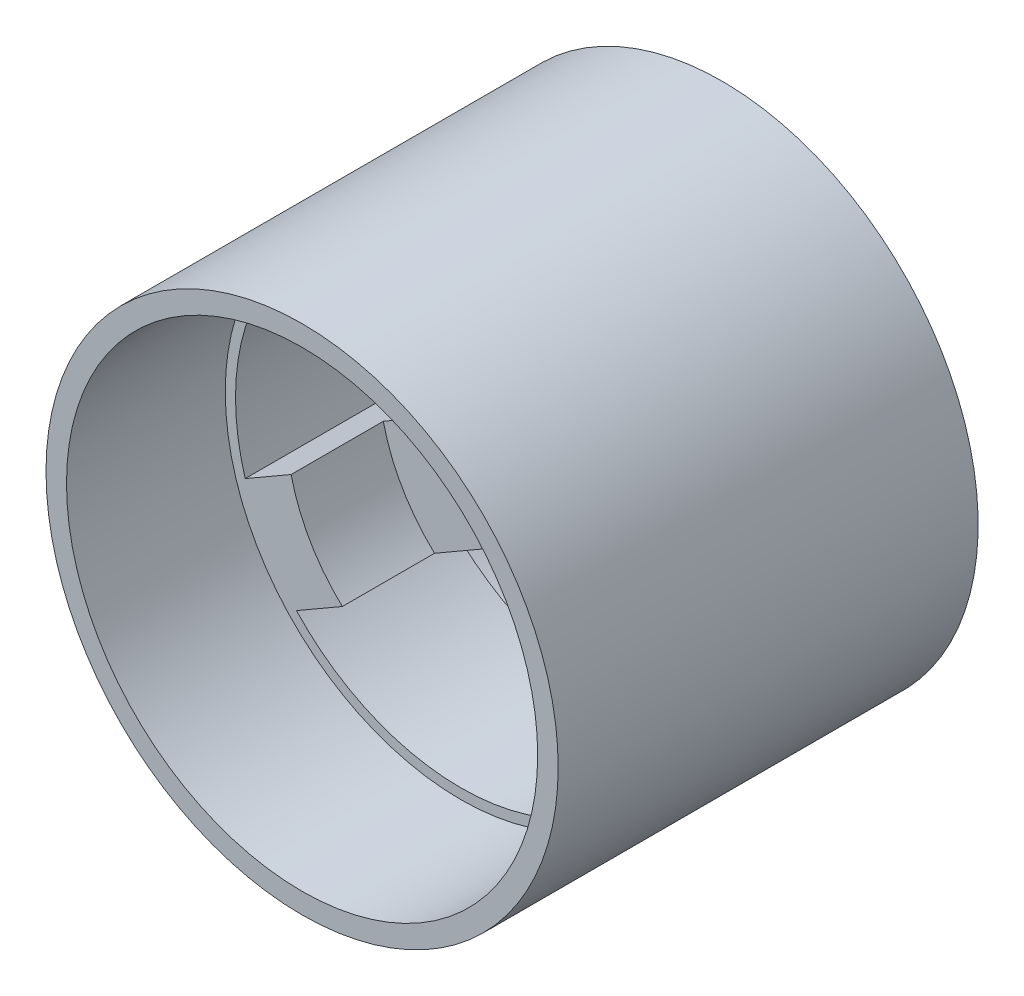
from build123d import *

# Parameters (mm, degrees)
SKETCH_1_R          = 22
SKETCH_1_R_2        = 17
EXTRUDE_1_DEPTH     = 9
EXTRUDE_START       = 3
SKETCH_2_R          = 22
EXTRUDE_2_DEPTH     = 3
SKETCH_3_R          = 1
CUT_EXTRUDE_1_DEPTH = 3
CUT_EXTRUDE_2_DEPTH = 25
SKETCH_5_R          = 4
CUT_EXTRUDE_3_DEPTH = 10
FILLET_1_R          = 10
FILLET_2_R          = 10
SKETCH_7_R          = 25
SKETCH_7_R_2        = 22
EXTRUDE_3_DEPTH     = 30
EXTRUDE_START_2     = 4
EXTRUDE_4_DEPTH     = 4
SKETCH_9_R          = 38.67245247
CUT_EXTRUDE_4_DEPTH = 1
EXTRUDE_START_3     = 13.5
SKETCH_10_R         = 25
SKETCH_10_R_2       = 22
EXTRUDE_5_DEPTH     = 13.5
SKETCH_11_R         = 23
CUT_EXTRUDE_5_DEPTH = 10.5
CHAMFER_2_SIZE      = 1
CUT_EXTRUDE_START   = -18
SKETCH_12_R         = 23
CUT_EXTRUDE_6_DEPTH = 18
SKETCH_13_R         = 39.83087954
CUT_EXTRUDE_7_DEPTH = 2.5


with BuildPart() as part:
    # 草图1 → 凸台-拉伸1 (new body)
    with BuildSketch(Plane.XY):
        Circle(SKETCH_1_R)
        Circle(SKETCH_1_R_2, mode=Mode.SUBTRACT)
    extrude(amount=EXTRUDE_1_DEPTH)

    # 草图2 → 凸台-拉伸2 (add)
    with BuildSketch(Plane(origin=(0, 0, 0), x_dir=(-1, 0, 0), z_dir=(0, 0, -1)).offset(EXTRUDE_START)):
        Circle(SKETCH_2_R)
    extrude(amount=-EXTRUDE_2_DEPTH)

    # 草图3 → 切除-拉伸1 (cut)
    with BuildSketch(Plane(origin=(0, 0, -3), x_dir=(-1, 0, 0), z_dir=(0, 0, -1))):
        with Locations((0, 10)):
            Circle(SKETCH_3_R)
        with Locations((8.660254038, -5)):
            Circle(SKETCH_3_R)
        with Locations((-8.660254038, -5)):
            Circle(SKETCH_3_R)
    extrude(amount=-CUT_EXTRUDE_1_DEPTH, mode=Mode.SUBTRACT)

    # 草图4 → 切除-拉伸2 (cut)
    with BuildSketch(Plane(origin=(0, 0, -3), x_dir=(-1, 0, 0), z_dir=(0, 0, -1))):
        Polygon((24.787699458, -8.537682263), (5, 2.886751346), (5, 15), (5, 31.006622637), (28.596284234, 19.54376122), align=None)
        Polygon((-6.160254038, -9.330127019), (0, -5.773502692), (19.787699458, -17.197936301), (-4.03507969, -32.43608202), (-23.902747272, -19.573760264), align=None)
        Polygon((-5, 10), (-5, 2.886751346), (-28.902747272, -10.913506226), (-27.638085306, 27.170625695), (-5, 31.006622637), align=None)
    extrude(amount=-CUT_EXTRUDE_2_DEPTH, mode=Mode.SUBTRACT)

    # 草图5 → 切除-拉伸3 (cut)
    with BuildSketch(Plane(origin=(0, 0, -3), x_dir=(-1, 0, 0), z_dir=(0, 0, -1))):
        Circle(SKETCH_5_R)
    extrude(amount=-CUT_EXTRUDE_3_DEPTH, mode=Mode.SUBTRACT)

    # 圆角1
    fillet_1_edges = [part.edges().sort_by_distance(p)[0] for p in [
        (-5, 2.886751346, -1.5),
    ]]
    fillet(fillet_1_edges, radius=FILLET_1_R)

    # 圆角2
    fillet_2_edges = [part.edges().sort_by_distance(p)[0] for p in [
        (5, 2.886751346, -1.5),
        (0, -5.773502692, -1.5),
    ]]
    fillet(fillet_2_edges, radius=FILLET_2_R)

    # 草图7 → 凸台-拉伸3 (add)
    with BuildSketch(Plane(origin=(0, 0, -3), x_dir=(-1, 0, 0), z_dir=(0, 0, -1))):
        Circle(SKETCH_7_R)
        Circle(SKETCH_7_R_2, mode=Mode.SUBTRACT)
    extrude(amount=-EXTRUDE_3_DEPTH)

    # 草图8 → 凸台-拉伸4 (add)
    with BuildSketch(Plane(origin=(0, 0, -3), x_dir=(-1, 0, 0), z_dir=(0, 0, -1)).offset(EXTRUDE_START_2)):
        with BuildLine():
            Line((-21.053975315, -6.382015624), (-15.753584421, -3.321833514))
            ThreePointArc((-15.753584421, -3.321833514), (-13.943009001, -8.05), (-10.753584421, -11.982087552))
            Line((-10.753584421, -11.982087552), (-16.053975315, -15.042269662))
            ThreePointArc((-16.053975315, -15.042269662), (-19.052558883, -11), (-21.053975315, -6.382015624))
        make_face()
        with BuildLine():
            Line((16.053975315, -15.042269662), (10.753584421, -11.982087552))
            ThreePointArc((10.753584421, -11.982087552), (13.943009001, -8.05), (15.753584421, -3.321833514))
            Line((15.753584421, -3.321833514), (21.053975315, -6.382015624))
            ThreePointArc((21.053975315, -6.382015624), (19.052558883, -11), (16.053975315, -15.042269662))
        make_face()
        with BuildLine():
            Line((5, 21.424285286), (5, 15.303921066))
            ThreePointArc((5, 15.303921066), (0, 16.1), (-5, 15.303921066))
            Line((-5, 15.303921066), (-5, 21.424285286))
            ThreePointArc((-5, 21.424285286), (0, 22), (5, 21.424285286))
        make_face()
    extrude(amount=-EXTRUDE_4_DEPTH)

    # 草图9 → 切除-拉伸4 (cut)
    with BuildSketch(Plane(origin=(0, 0, -7), x_dir=(-1, 0, 0), z_dir=(0, 0, -1))):
        Circle(SKETCH_9_R)
    extrude(amount=-CUT_EXTRUDE_4_DEPTH, mode=Mode.SUBTRACT)

    # 草图10 → 凸台-拉伸5 (add)
    with BuildSketch(Plane(origin=(0, 0, -3), x_dir=(-1, 0, 0), z_dir=(0, 0, -1)).offset(EXTRUDE_START_3)):
        Circle(SKETCH_10_R)
        Circle(SKETCH_10_R_2, mode=Mode.SUBTRACT)
    extrude(amount=-EXTRUDE_5_DEPTH)

    # 草图11 → 切除-拉伸5 (cut)
    with BuildSketch(Plane(origin=(0, 0, -16.5), x_dir=(-1, 0, 0), z_dir=(0, 0, -1))):
        Circle(SKETCH_11_R)
    extrude(amount=-CUT_EXTRUDE_5_DEPTH, mode=Mode.SUBTRACT)

    # 倒角2
    chamfer_2_edges = [part.edges().sort_by_distance(p)[0] for p in [
        (23, 0, -16.5),
    ]]
    chamfer(chamfer_2_edges, length=CHAMFER_2_SIZE)

    # 草图12 → 切除-拉伸6 (cut)
    with BuildSketch(Plane.XY.offset(27).offset(CUT_EXTRUDE_START)):
        Circle(SKETCH_12_R)
    extrude(amount=CUT_EXTRUDE_6_DEPTH, mode=Mode.SUBTRACT)

    # 草图13 → 切除-拉伸7 (cut)
    with BuildSketch(Plane.XY.offset(27)):
        Circle(SKETCH_13_R)
    extrude(amount=-CUT_EXTRUDE_7_DEPTH, mode=Mode.SUBTRACT)


solid = part.part
